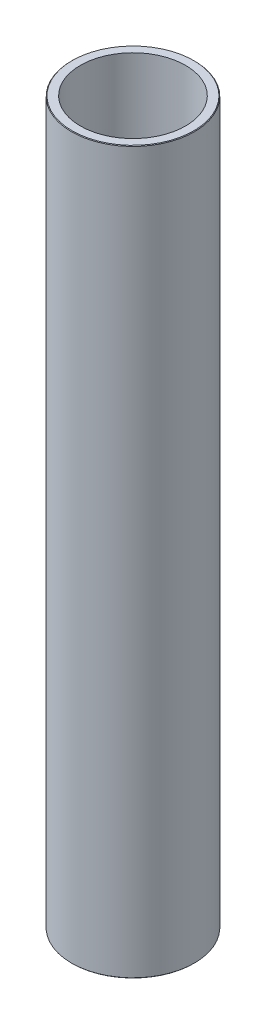
from build123d import *

# Parameters (mm, degrees)
SKETCH1_R           = 50
BOSS_EXTRUDE1_DEPTH = 587.045592342
SKETCH2_R           = 42.811026433
CUT_EXTRUDE1_DEPTH  = 592.288869748
CHAMFER1_SIZE       = 0.478683625


with BuildPart() as part:
    # Sketch1 → Boss-Extrude1 (new body)
    with BuildSketch(Plane(origin=(0, 0, 0), x_dir=(1, 0, 0), z_dir=(0, 1, 0))):
        Circle(SKETCH1_R)
    extrude(amount=BOSS_EXTRUDE1_DEPTH)

    # Sketch2 → Cut-Extrude1 (cut, through all)
    with BuildSketch(Plane(origin=(0, 0, 0), x_dir=(1, 0, 0), z_dir=(0, 1, 0))):
        Circle(SKETCH2_R)
    extrude(amount=CUT_EXTRUDE1_DEPTH, mode=Mode.SUBTRACT)

    # Chamfer1
    chamfer1_edges = [part.edges().sort_by_distance(p)[0] for p in [
        (-50, 587.045592342, 0),
        (-50, 0, 0),
    ]]
    chamfer(chamfer1_edges, length=CHAMFER1_SIZE)


solid = part.part
